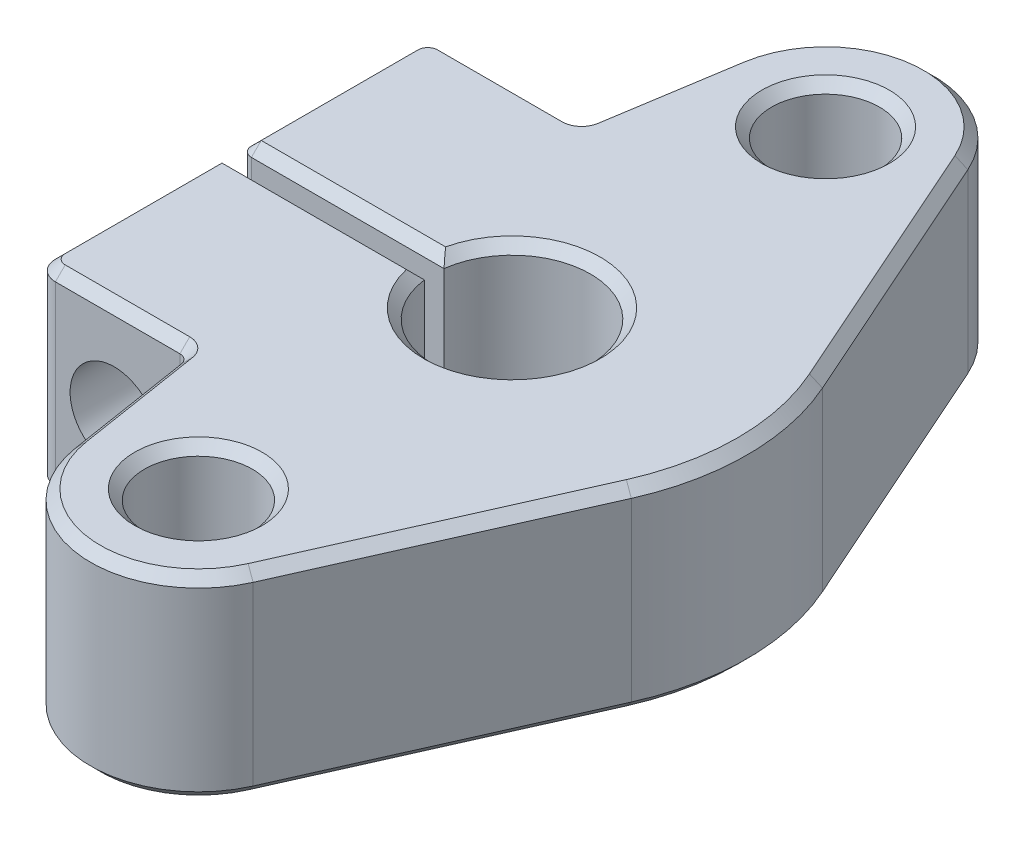
from build123d import *

# Parameters (mm, degrees)
SKETCH_1_R          = 2.75
EXTRUDE_1_DEPTH     = 10
CUT_EXTRUDE_1_REACH = 38.009
SKETCH_3_R          = 2.25
SKETCH_3_3_R        = 1.65
CUT_EXTRUDE_2_DEPTH = 37.00893353
FILLET_1_R          = 1
FILLET_2_R          = 0.5
CHAMFER_1_SIZE      = 0.5


with BuildPart() as part:
    # 草图1 → 凸台-拉伸1 (new body)
    with BuildSketch(Plane(origin=(0, 0, 0), x_dir=(1, 0, 0), z_dir=(0, 1, 0))):
        with BuildLine():
            ThreePointArc((5.025690834, 18.234375), (-0.716951035, 21.453070806), (-5.432446466, 16.859375))
            Line((-5.432446466, 16.859375), (-6.517551571, 10))
            Line((-6.517551571, 10), (-14.296618271, 10))
            Line((-14.296618271, 10), (-14.296618271, 0.5))
            Line((-14.296618271, 0.5), (-3.968626967, 0.5))
            ThreePointArc((-3.968626967, 0.5), (4, 0), (-3.968626967, -0.5))
            Line((-3.968626967, -0.5), (-14.296618271, -0.5))
            Line((-14.296618271, -0.5), (-14.296618271, -10))
            Line((-14.296618271, -10), (-6.517551571, -10))
            Line((-6.517551571, -10), (-5.432446466, -16.859375))
            ThreePointArc((-5.432446466, -16.859375), (-0.716951035, -21.453070806), (5.025690834, -18.234375))
            Line((5.025690834, -18.234375), (10.965143638, -4.875))
            ThreePointArc((10.965143638, -4.875), (12, 0), (10.965143638, 4.875))
            Line((10.965143638, 4.875), (5.025690834, 18.234375))
        make_face()
        with Locations(Location((0, -16, 0), (0, 0, 270))):
            Circle(SKETCH_1_R, mode=Mode.SUBTRACT)
        with Locations(Location((0, 16, 0), (0, 0, 270))):
            Circle(SKETCH_1_R, mode=Mode.SUBTRACT)
    extrude(amount=EXTRUDE_1_DEPTH)

    # 草图3 → 切除-拉伸1 (cut, up to next)
    with BuildSketch(Plane.XY.offset(10), mode=Mode.PRIVATE) as cut_extrude_1_sk1:
        with Locations((-10.296618271, 5)):
            Circle(SKETCH_3_R)
    cut_extrude_1_tool1 = extrude(cut_extrude_1_sk1.sketch, amount=-CUT_EXTRUDE_1_REACH, mode=Mode.PRIVATE) & part.part
    add(cut_extrude_1_tool1.solids().sort_by_distance((-10.296618, 5, 10))[0], mode=Mode.SUBTRACT)

    # 草图3<3> → 切除-拉伸2 (cut, through all)
    with BuildSketch(Plane.XY.offset(10)):
        with Locations(Location((-10.296618271, 5, 0), (0, 0, 180))):
            Circle(SKETCH_3_3_R)
    extrude(amount=-CUT_EXTRUDE_2_DEPTH, mode=Mode.SUBTRACT)

    # 圆角1
    fillet_1_edges = [part.edges().sort_by_distance(p)[0] for p in [
        (-14.296618271, 5, 10),
        (-14.296618271, 5, -10),
    ]]
    fillet(fillet_1_edges, radius=FILLET_1_R)

    # 圆角2
    fillet_2_edges = [part.edges().sort_by_distance(p)[0] for p in [
        (-6.517551571, 5, 10),
        (-14.296618271, 5, 0.5),
        (-14.296618271, 5, -0.5),
        (-6.517551571, 5, -10),
    ]]
    fillet(fillet_2_edges, radius=FILLET_2_R)

    # 倒角1
    chamfer_1_edges = [part.edges().sort_by_distance(p)[0] for p in [
        (-6.619913143, 0, 10.119827342),
        (-6.619913143, 10, 10.119827342),
        (-6.619913143, 0, -10.119827342),
        (-6.619913143, 10, -10.119827342),
        (-0.716951035, 10, 21.453070806),
        (7.995417236, 10, 11.5546875),
        (0, 0, 13.25),
        (0, 0, -18.75),
        (4, 0, 0),
        (12, 10, 0),
        (-5.941630183, 0, -13.640625),
        (-0.716951035, 0, -21.453070806),
        (7.995417236, 0, -11.5546875),
        (12, 0, 0),
        (7.995417236, 0, 11.5546875),
        (-0.716951035, 0, 21.453070806),
        (-5.941630183, 0, 13.640625),
        (7.995417236, 10, -11.5546875),
        (-0.716951035, 10, -21.453070806),
        (-5.941630183, 10, -13.640625),
        (4, 10, 0),
        (-14.296618271, 0, -5),
        (-14.296618271, 10, -5),
        (-10.12064547, 0, 10),
        (-10.12064547, 0, -10),
        (-14.003725052, 0, 9.707106781),
        (-14.003725052, 0, -9.707106781),
        (-10.12064547, 10, -10),
        (-5.941630183, 10, 13.640625),
        (-10.12064547, 10, 10),
        (-14.003725052, 10, 9.707106781),
        (-14.003725052, 10, -9.707106781),
        (0, 10, -18.75),
        (-8.882622619, 0, -0.5),
        (-8.882622619, 10, -0.5),
        (0, 10, 13.25),
        (-14.296618271, 0, 5),
        (-8.882622619, 0, 0.5),
        (-14.150171662, 0, 0.646446609),
        (-14.150171662, 0, -0.646446609),
        (-8.882622619, 10, 0.5),
        (-14.296618271, 10, 5),
        (-14.150171662, 10, 0.646446609),
        (-14.150171662, 10, -0.646446609),
    ]]
    chamfer(chamfer_1_edges, length=CHAMFER_1_SIZE - 0.0001)  # a hair under: the kernel refuses the full size


solid = part.part
